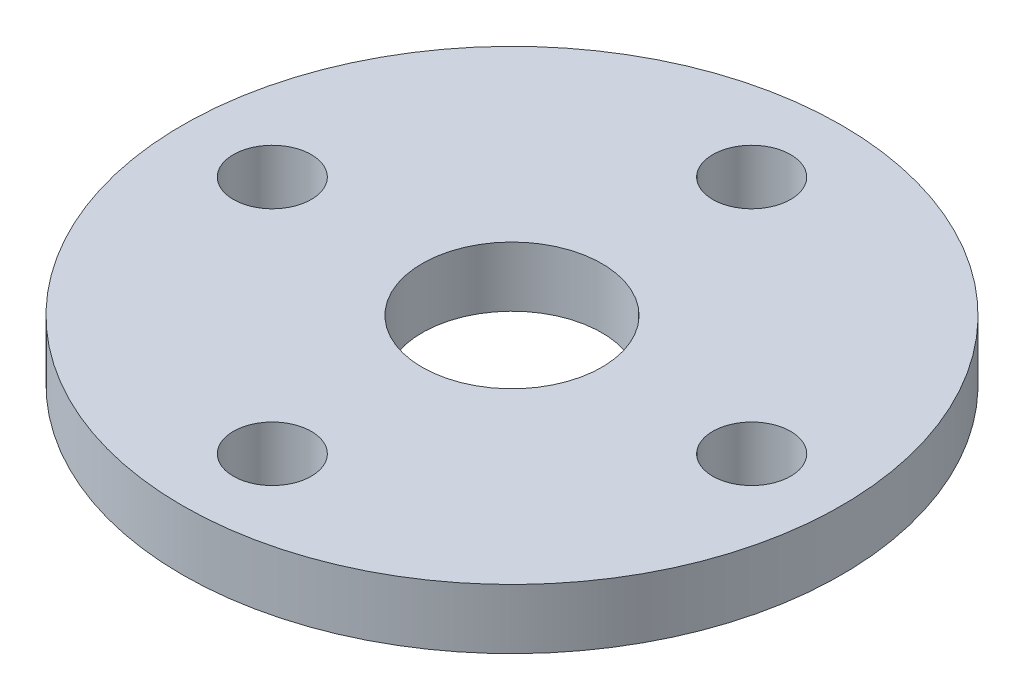
from build123d import *

# Parameters (mm, degrees)
SKETCH_1_R      = 11
SKETCH_1_R_2    = 1.3
SKETCH_1_R_3    = 3
EXTRUDE_1_DEPTH = 2


with BuildPart() as part:
    # 草圖1 → 填料-伸長1 (new body)
    with BuildSketch(Plane(origin=(0, 0, 0), x_dir=(1, 0, 0), z_dir=(0, 1, 0))):
        Circle(SKETCH_1_R)
        with Locations((0, 8)):
            Circle(SKETCH_1_R_2, mode=Mode.SUBTRACT)
        with Locations((8, 0)):
            Circle(SKETCH_1_R_2, mode=Mode.SUBTRACT)
        with Locations((0, -8)):
            Circle(SKETCH_1_R_2, mode=Mode.SUBTRACT)
        with Locations((-8, 0)):
            Circle(SKETCH_1_R_2, mode=Mode.SUBTRACT)
        Circle(SKETCH_1_R_3, mode=Mode.SUBTRACT)
    extrude(amount=EXTRUDE_1_DEPTH)


solid = part.part
